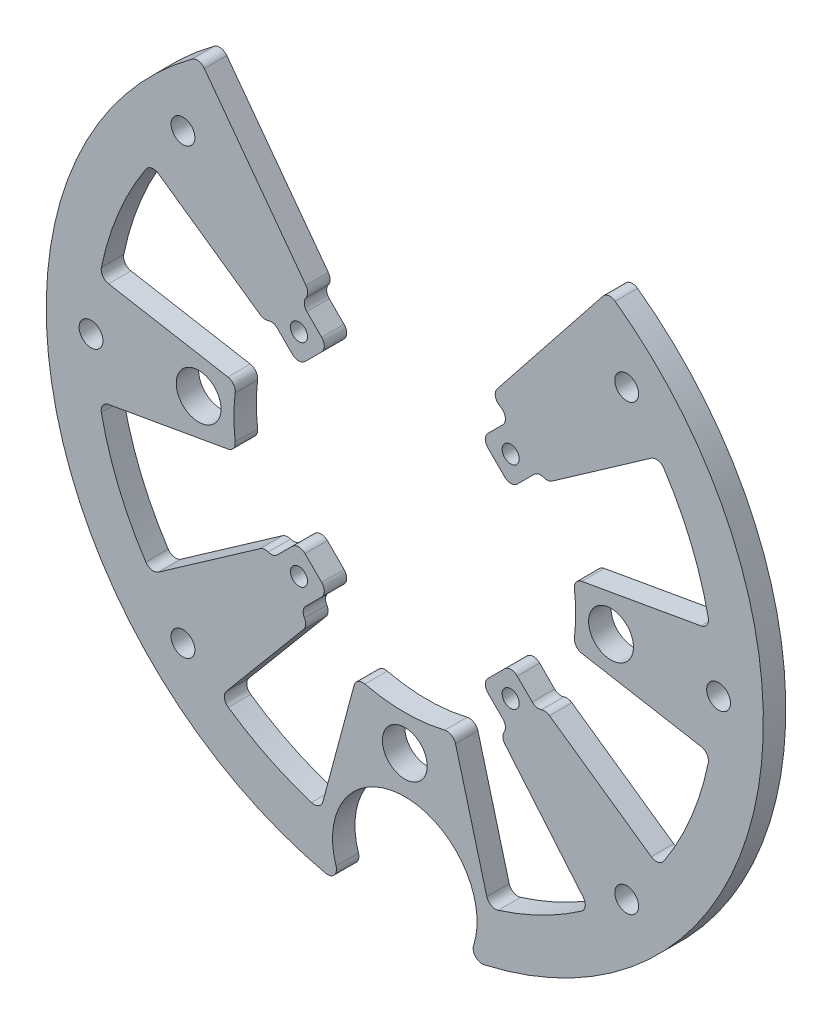
from build123d import *

# Parameters (mm, degrees)
SKETCH1_R               = 101.6
SKETCH1_R_2             = 48.435876627
EXTRUDE1_DEPTH          = 6.35
F_1_4_CLEARANCE_HOLE1_D = 6.7564
SKETCH11_R              = 20.478678418
CUT_EXTRUDE1_DEPTH      = 144.824345992
SKETCH12_R              = 6.35
CUT_EXTRUDE2_DEPTH      = 144.824345992
SKETCH13_R              = 2.426498152
EXTRUDE2_DEPTH          = 6.35
CUT_EXTRUDE3_DEPTH      = 6.35
FILLET1_R               = 2.54
FILLET2_R               = 2.54
FILLET3_R               = 2.54
FILLET4_R               = 2.54
FILLET5_R               = 2.54
FILLET6_R               = 2.54


with BuildPart() as part:
    # Sketch1 → Extrude1 (new body)
    with BuildSketch(Plane.XY):
        Circle(SKETCH1_R)
        Circle(SKETCH1_R_2, mode=Mode.SUBTRACT)
    extrude(amount=EXTRUDE1_DEPTH)

    # 1/4 Clearance Hole1 (through all)
    with Locations(Plane.XY.offset(6.35)):
        with Locations((62.861792847, -62.861792847), (88.9, 0), (62.861792847, 62.861792847), (-62.861792847, 62.861792847), (-88.9, 0), (-62.861792847, -62.861792847)):
            Hole(F_1_4_CLEARANCE_HOLE1_D / 2)

    # Sketch11 → Cut-Extrude1 (cut, through all)
    with BuildSketch(Plane.XY.offset(6.35)):
        with Locations((0, -89.535)):
            Circle(SKETCH11_R)
    extrude(amount=-CUT_EXTRUDE1_DEPTH, mode=Mode.SUBTRACT)

    # Sketch12 → Cut-Extrude2 (cut, through all)
    with BuildSketch(Plane.XY.offset(6.35)):
        with Locations((0, -58.42)):
            Circle(SKETCH12_R)
        with Locations((-58.42, 0)):
            Circle(SKETCH12_R)
        with Locations((58.42, 0)):
            Circle(SKETCH12_R)
    extrude(amount=-CUT_EXTRUDE2_DEPTH, mode=Mode.SUBTRACT)

    # Sketch13 → Extrude2 (add)
    # profile 1 of 4: a face of its own
    with BuildSketch(Plane.XY.offset(6.35)):
        Polygon((30.067243726, -21.76182967), (44.903973325, -36.598559269), (36.598559269, -44.903973325), (21.76182967, -30.067243726), align=None)
        with Locations((29.99994, -29.99994)):
            Circle(SKETCH13_R, mode=Mode.SUBTRACT)
    # profile 2 of 4: a face of its own
    with BuildSketch(Plane.XY.offset(6.35)):
        Polygon((-30.067243726, -21.76182967), (-44.903973325, -36.598559269), (-36.598559269, -44.903973325), (-21.76182967, -30.067243726), align=None)
        with Locations((-29.99994, -29.99994)):
            Circle(SKETCH13_R, mode=Mode.SUBTRACT)
    # profile 3 of 4: a face of its own
    with BuildSketch(Plane.XY.offset(6.35)):
        Polygon((-30.067243726, 21.76182967), (-21.76182967, 30.067243726), (-36.598559269, 44.903973325), (-44.903973325, 36.598559269), align=None)
        with Locations((-29.99994, 29.99994)):
            Circle(SKETCH13_R, mode=Mode.SUBTRACT)
    # profile 4 of 4: a face of its own
    with BuildSketch(Plane.XY.offset(6.35)):
        Polygon((30.067243726, 21.76182967), (21.76182967, 30.067243726), (36.598559269, 44.903973325), (44.903973325, 36.598559269), align=None)
        with Locations((29.99994, 29.99994)):
            Circle(SKETCH13_R, mode=Mode.SUBTRACT)
    extrude(amount=-EXTRUDE2_DEPTH)

    # Sketch14 → Cut-Extrude3 (cut)
    with BuildSketch(Plane.XY.offset(6.35)):
        with BuildLine():
            Line((12.028575829, 26.284689432), (72.48616559, 102.388479134))
            Line((72.48616559, 102.388479134), (0, 148.475476712))
            Line((0, 148.475476712), (-72.48616559, 102.388479134))
            Line((-72.48616559, 102.388479134), (-14.952580365, 24.738469546))
            ThreePointArc((-14.952580365, 24.738469546), (-1.653828775, 28.858904786), (12.028575829, 26.284689432))
        make_face()
        with BuildLine():
            Line((8.652633897, -27.580853172), (23.900424698, -84.486383146))
            ThreePointArc((23.900424698, -84.486383146), (38.731626443, -78.797464115), (52.295107345, -70.52943347))
            Line((52.295107345, -70.52943347), (14.227637724, -25.162389788))
            ThreePointArc((14.227637724, -25.162389788), (11.503866682, -26.518532886), (8.652633897, -27.580853172))
        make_face()
        with BuildLine():
            Line((-71.923131973, 50.361119179), (-23.678617266, 16.579946304))
            ThreePointArc((-23.678617266, 16.579946304), (-26.705896668, 11.061944595), (-28.467103301, 5.019518375))
            Line((-28.467103301, 5.019518375), (-86.468023222, 15.246645463))
            ThreePointArc((-86.468023222, 15.246645463), (-81.118407758, 33.600344651), (-71.923131973, 50.361119179))
        make_face()
        with BuildLine():
            Line((-8.652154992, -27.581003409), (-23.900424698, -84.486383146))
            ThreePointArc((-23.900424698, -84.486383146), (-38.731626443, -78.797464115), (-52.295107345, -70.52943347))
            Line((-52.295107345, -70.52943347), (-14.229539169, -25.161314554))
            ThreePointArc((-14.229539169, -25.161314554), (-11.504638432, -26.518198083), (-8.652154992, -27.581003409))
        make_face()
        with BuildLine():
            Line((-86.468023222, -15.246645463), (-28.467103301, -5.019518375))
            ThreePointArc((-28.467103301, -5.019518375), (-26.705896668, -11.061944595), (-23.678617266, -16.579946304))
            Line((-23.678617266, -16.579946304), (-71.923131973, -50.361119179))
            ThreePointArc((-71.923131973, -50.361119179), (-81.118407758, -33.600344651), (-86.468023222, -15.246645463))
        make_face()
        with BuildLine():
            Line((23.678617266, -16.579946304), (71.923131973, -50.361119179))
            ThreePointArc((71.923131973, -50.361119179), (81.118407758, -33.600344651), (86.468023222, -15.246645463))
            Line((86.468023222, -15.246645463), (28.467103301, -5.019518375))
            ThreePointArc((28.467103301, -5.019518375), (26.705896668, -11.061944595), (23.678617266, -16.579946304))
        make_face()
        with BuildLine():
            Line((28.467103301, 5.019518375), (86.468023222, 15.246645463))
            ThreePointArc((86.468023222, 15.246645463), (81.118407758, 33.600344651), (71.923131973, 50.361119179))
            Line((71.923131973, 50.361119179), (23.678617266, 16.579946304))
            ThreePointArc((23.678617266, 16.579946304), (26.705896668, 11.061944595), (28.467103301, 5.019518375))
        make_face()
    extrude(amount=-CUT_EXTRUDE3_DEPTH, mode=Mode.SUBTRACT)

    # Fillet1
    fillet1_edges = [part.edges().sort_by_distance(p)[0] for p in [
        (-21.76182967, 30.067243726, 3.175),
        (-30.067243726, 21.76182967, 3.175),
        (21.76182967, 30.067243726, 3.175),
        (30.067243726, 21.76182967, 3.175),
        (-58.28362304, 83.220065401, 3.175),
        (52.295107345, -70.52943347, 3.175),
        (23.900424698, -84.486383146, 3.175),
        (-23.900424698, -84.486383146, 3.175),
        (-52.295107345, -70.52943347, 3.175),
        (47.700026827, -8.41080171, 3.175),
        (86.468023222, -15.246645463, 3.175),
        (71.923131973, -50.361119179, 3.175),
        (-71.923131973, -50.361119179, 3.175),
        (-86.468023222, -15.246645463, 3.175),
        (71.923131973, 50.361119179, 3.175),
        (86.468023222, 15.246645463, 3.175),
        (-86.468023222, 15.246645463, 3.175),
        (-71.923131973, 50.361119179, 3.175),
        (29.843941288, -38.149355343, 3.175),
        (30.067243726, -21.76182967, 3.175),
        (21.76182967, -30.067243726, 3.175),
        (-21.76182967, -30.067243726, 3.175),
        (-30.067243726, -21.76182967, 3.175),
    ]]
    fillet(fillet1_edges, radius=FILLET1_R)

    # Fillet2
    # the kernel refuses this fillet: 2.54 mm, written as the material it adds along each edge
    with BuildSketch(Plane(origin=(-38.149355343, -29.843941288, 6.35), x_dir=(-0.5950738455841501, 0.8036710261678537, 0), z_dir=(0, 0, -1))) as fillet2_piece_1:
        with BuildLine():
            CenterArc((2.942696634, 2.511919748), FILLET2_R, 171.517896562, 89.954594463)
            Line((0.430479195, 2.88657097), (0, 0))
            ThreePointArc((0, 0), (1.283027329, -0.016996162), (2.566054658, 0))
        make_face()
    extrude(amount=6.35)
    # the kernel refuses this fillet: 2.54 mm, written as the material it takes off along each edge
    with BuildSketch(Plane(origin=(39.676347356, 27.781677508, 12.541699401), x_dir=(-0.5938127759220886, 0.804603248285578, 0), z_dir=(0, 0, -1))) as fillet2_2_piece_1:
        with BuildLine():
            CenterArc((2.477488567, 2.539211105), FILLET2_R, 181.428043786, 87.143912429)
            Line((-0.061722539, 2.475910532), (0, 0))
            ThreePointArc((0, 0), (1.207093997, 0.015043624), (2.414187993, 0))
        make_face()
    extrude(amount=18.733398802, mode=Mode.SUBTRACT)

    # Fillet3
    # the kernel refuses this fillet: 2.54 mm, written as the material it adds along each edge
    with BuildSketch(Plane(origin=(38.149355343, -29.843941288, 6.35), x_dir=(-0.7071067811865487, 0.7071067811865462, 0), z_dir=(0, 0, -1))) as fillet3_piece_1:
        with BuildLine():
            CenterArc((2.918493499, 2.54), FILLET3_R, 180.045405537, 89.954594463)
            ThreePointArc((0.378494296, 2.537987111), (0.172436891, 1.271500497), (0, 0))
            Line((0, 0), (2.918493499, 0))
        make_face()
    extrude(amount=6.35)
    with BuildSketch(Plane(origin=(-29.843941288, 38.149355343, 6.35), x_dir=(0.8065806519344794, 0.5911240579818674, 0), z_dir=(0, 0, -1))) as fillet3_piece_2:
        with BuildLine():
            CenterArc((2.961349729, 2.538748086), FILLET3_R, 171.236815401, 100.562162322)
            Line((0.451000474, 2.925719166), (0, 0))
            ThreePointArc((0, 0), (1.52054388, -0.023873044), (3.041087761, 0))
        make_face()
    extrude(amount=6.35)
    # the kernel refuses this fillet: 2.54 mm, written as the material it takes off along each edge
    with BuildSketch(Plane(origin=(26.907852458, -40.274081253, 12.135832501), x_dir=(0.6427876096865405, -0.766044443118977, 0), z_dir=(0, 0, -1))) as fillet3_2_piece_1:
        with BuildLine():
            CenterArc((2.314333001, -2.54), FILLET3_R, 90, 70.288335328)
            Line((-0.076827818, -1.683291217), (-0.3159439, -1.597620338))
            ThreePointArc((-0.3159439, -1.597620338), (-0.19275198, -0.605010424), (-0.252489157, -0.027662711))
            Line((-0.252489157, -0.027662711), (0, 0.254))
            Line((0, 0.254), (2.314333001, 0.254))
            Line((2.314333001, 0.254), (2.314333001, 0))
        make_face()
    extrude(amount=17.921665003, mode=Mode.SUBTRACT)
    with BuildSketch(Plane(origin=(13.709958303, -46.455044807, 12.695601727), x_dir=(-0.9660206148643551, -0.2584650298533505, 0), z_dir=(0, 0, -1))) as fillet3_2_piece_2:
        with BuildLine():
            CenterArc((2.539069601, -2.539171394), FILLET3_R, 91.463547204, 88.51545472)
            Line((-0.000930229, -2.53824052), (0, 0))
            ThreePointArc((0, 0), (1.237097807, -0.015800898), (2.474195614, 0))
        make_face()
    extrude(amount=19.041203453, mode=Mode.SUBTRACT)

    # Fillet4
    # the kernel refuses this fillet: 2.54 mm, written as the material it adds along each edge
    with BuildSketch(Plane(origin=(-38.149355343, 29.843941288, 6.35), x_dir=(0.7071067811865469, -0.707106781186548, 0), z_dir=(0, 0, -1))) as fillet4_piece_1:
        with BuildLine():
            CenterArc((2.918493499, 2.54), FILLET4_R, 180.045405537, 89.954594463)
            ThreePointArc((0.378494296, 2.537987111), (0.172436891, 1.271500497), (0, 0))
            Line((0, 0), (2.918493499, 0))
        make_face()
    extrude(amount=6.35)
    # the kernel refuses this fillet: 2.54 mm, written as the material it takes off along each edge
    with BuildSketch(Plane(origin=(-47.700026827, -8.41080171, 12.541699401), x_dir=(-0.14905137241773606, 0.9888294536371727, 0), z_dir=(0, 0, -1)), Plane(origin=(47.700026827, 8.41080171, 12.541699401), x_dir=(0.14905137241773964, -0.9888294536371721, 0), z_dir=(0, 0, -1))) as fillet4_2_piece_1:
        with BuildLine():
            CenterArc((2.477488567, -2.539211105), FILLET4_R, 91.428043786, 87.143912429)
            Line((-0.061722539, -2.475910532), (0, 0))
            ThreePointArc((0, 0), (1.207093997, -0.015043624), (2.414187993, 0))
        make_face()
    extrude(amount=18.733398802, mode=Mode.SUBTRACT)
    with BuildSketch(Plane(origin=(17.560484701, -100.070921736, 18.861181089), x_dir=(0.9803945166851711, 0.19704464380857967, 0), z_dir=(0, 0, -1))) as fillet4_2_piece_2:
        with BuildLine():
            CenterArc((4.94191653, -2.53922956), FILLET4_R, 88.588759135, 120.669556016)
            ThreePointArc((2.725956812, -3.780649122), (1.470887681, -1.812518868), (0, 0))
            ThreePointArc((0, 0), (2.502236218, 0.030817598), (5.004472435, 0))
        make_face()
    extrude(amount=31.372362177, mode=Mode.SUBTRACT)
    with BuildSketch(Plane(origin=(24.390914285, 41.846355218, 13.472532368), x_dir=(0.8491621946398489, -0.5281321493664586, 0), z_dir=(0, 0, -1))) as fillet4_2_piece_3:
        with BuildLine():
            CenterArc((2.849943346, -2.538956025), FILLET4_R, 91.642784634, 94.941847216)
            Line((0.326698306, -2.830219601), (0, 0))
            ThreePointArc((0, 0), (1.388563221, -0.019907807), (2.777126442, 0))
        make_face()
    extrude(amount=20.595064737, mode=Mode.SUBTRACT)
    with BuildSketch(Plane(origin=(-26.609815652, 40.471617902, 12.24155284), x_dir=(-0.7798923981338155, -0.6259136101197083, 0), z_dir=(0, 0, -1))) as fillet4_2_piece_4:
        with BuildLine():
            CenterArc((2.447095276, 2.45295493), FILLET4_R, 182.213245662, 72.743528001)
            Line((-0.091009923, 2.354863132), (-0.344820443, 2.345053953))
            Line((-0.344820443, 2.345053953), (-0.25381052, -0.00980918))
            Line((-0.25381052, -0.00980918), (0.024012194, -0.252862442))
            ThreePointArc((0.024012194, -0.252862442), (0.956736499, -0.173423977), (1.721918984, -0.245295493))
            Line((1.721918984, -0.245295493), (1.787844102, 0))
        make_face()
    extrude(amount=18.133105679, mode=Mode.SUBTRACT)
    with BuildSketch(Plane(origin=(39.676347356, -27.781677508, 10.377126904), x_dir=(-0.8480711193304941, -0.5298824176716216, 0), z_dir=(0, 0, -1))) as fillet4_2_piece_5:
        with BuildLine():
            CenterArc((1.708565245, -2.475327247), FILLET4_R, 102.957083854, 54.040426754)
            Line((-0.62947396, -1.482768596), (0, 0))
            ThreePointArc((0, 0), (0.569521748, -0.064672753), (1.139043497, 0))
        make_face()
    extrude(amount=14.404253807, mode=Mode.SUBTRACT)
    with BuildSketch(Plane(origin=(57.623035007, 83.678825497, 12.428140181), x_dir=(-0.6220223792607296, -0.782999463409025, 0), z_dir=(0, 0, -1))) as fillet4_2_piece_6:
        with BuildLine():
            CenterArc((2.400673018, -2.54), FILLET4_R, 90, 87.459264669)
            ThreePointArc((-0.136830054, -2.42740265), (-0.07567616, -1.213292023), (0, 0))
            Line((0, 0), (2.400673018, 0))
        make_face()
    extrude(amount=18.506280363, mode=Mode.SUBTRACT)

    # Fillet5
    fillet5_edges = [part.edges().sort_by_distance(p)[0] for p in [
        (-26.909050546, -40.273280762, 3.175),
        (-13.709636762, -46.4551397, 3.175),
        (-39.676347356, 27.781677508, 3.175),
        (-47.700026827, 8.41080171, 3.175),
        (-17.560484701, -100.070921736, 3.175),
    ]]
    fillet(fillet5_edges, radius=FILLET5_R)

    # Fillet6
    fillet6_edges = [part.edges().sort_by_distance(p)[0] for p in [
        (-29.843941288, -38.149355343, 3.175),
        (-39.676347356, -27.781677508, 3.175),
        (38.149355343, 29.843941288, 3.175),
        (29.843941288, 38.149355343, 3.175),
    ]]
    fillet(fillet6_edges, radius=FILLET6_R)


solid = part.part
